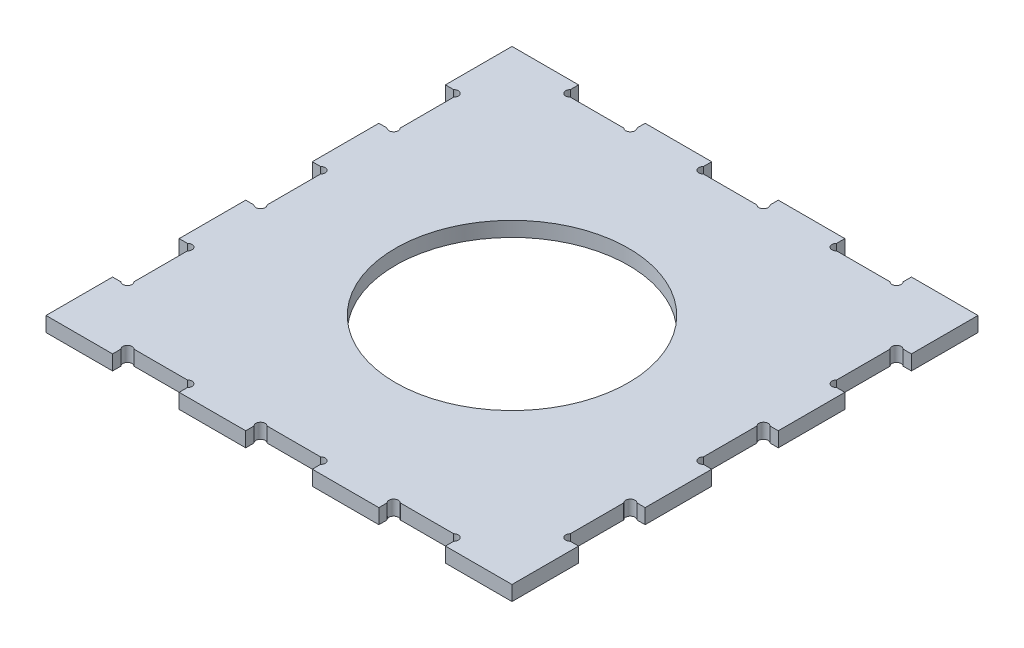
from build123d import *

# Parameters (mm, degrees)
SKETCH1_W                   = 100
SKETCH1_H                   = 100
BOSS_EXTRUDE1_DEPTH         = 3.18
SKETCH2_W                   = 14.285714285
SKETCH2_H                   = 3.18
SKETCH2_W_2                 = 14.285714286
CUT_EXTRUDE1_DEPTH          = 71.782147467
SKETCH3_R                   = 1
CUT_EXTRUDE2_DEPTH          = 71.782147467
SKETCH_PATTERN1_DEPTH       = 3.18
CIRPATTERN1_COUNT           = 4
CIRPATTERN1_COPY_1_SKETCH_R = 1
CIRPATTERN1_COPY_1_DEPTH    = 71.782147467
CIRPATTERN1_COPY_2_SKETCH_R = 1
CIRPATTERN1_COPY_2_DEPTH    = 71.782147467
CIRPATTERN1_COPY_3_SKETCH_R = 1
CIRPATTERN1_COPY_3_DEPTH    = 71.782147467
CIRPATTERN1_COPY_4_DEPTH    = 3.18
CIRPATTERN1_COPY_5_DEPTH    = 3.18
CIRPATTERN1_COPY_6_DEPTH    = 3.18
CUT_EXTRUDE3_DEPTH          = 71.782147467
CUT_EXTRUDE3_DEPTH_BACK     = 71.782147467
SKETCH5_R                   = 25


# Read off the part's stored shape, not the designer's step: Sketch-Pattern1
with BuildPart() as part:
    # Sketch1 → Boss-Extrude1 (new body)
    with BuildSketch(Plane(origin=(0, 0, 0), x_dir=(1, 0, 0), z_dir=(0, 1, 0))):
        Rectangle(SKETCH1_W, SKETCH1_H)
    extrude(amount=BOSS_EXTRUDE1_DEPTH)

    # Sketch2 → Cut-Extrude1 (cut, symmetric)
    with BuildSketch(Plane(origin=(0, 3.18, 0), x_dir=(1, 0, 0), z_dir=(0, 1, 0))):
        with Locations((-28.571428572, 48.41)):
            Rectangle(SKETCH2_W, SKETCH2_H)
        with Locations((0, 48.41)):
            Rectangle(SKETCH2_W_2, SKETCH2_H)
        with Locations((28.571428572, 48.41)):
            Rectangle(SKETCH2_W, SKETCH2_H)
    cut_extrude1 = extrude(amount=CUT_EXTRUDE1_DEPTH, both=True, mode=Mode.SUBTRACT)

    # Sketch3 → Cut-Extrude2 (cut, symmetric)
    with BuildSketch(Plane(origin=(0, 3.18, 0), x_dir=(1, 0, 0), z_dir=(0, 1, 0))):
        with Locations((-35.007178933, 47.527106781)):
            Circle(SKETCH3_R)
    cut_extrude2 = extrude(amount=CUT_EXTRUDE2_DEPTH, both=True, mode=Mode.SUBTRACT)

    # Sketch-Pattern1 outline → Sketch-Pattern1 (cut)
    with BuildSketch(Plane(origin=(0, 0, 0), x_dir=(1, 0, 0), z_dir=(0, 1, 0))):
        with BuildLine():
            Line((-7.142857143, 46.82), (-7.142857143, 48.234213562))
            ThreePointArc((-7.142857143, 48.234213562), (-7.435750362, 47.527106781), (-7.142857143, 46.82))
        make_face()
        with BuildLine():
            Line((-5.72864358, 46.82), (-7.142857143, 46.82))
            ThreePointArc((-7.142857143, 46.82), (-6.435750362, 46.527106781), (-5.72864358, 46.82))
        make_face()
        with BuildLine():
            Line((21.428571429, 46.82), (21.428571429, 48.234213562))
            ThreePointArc((21.428571429, 48.234213562), (21.13567821, 47.527106781), (21.428571429, 46.82))
        make_face()
        with BuildLine():
            Line((22.842784991, 46.82), (21.428571429, 46.82))
            ThreePointArc((21.428571429, 46.82), (22.13567821, 46.527106781), (22.842784991, 46.82))
        make_face()
    sketch_pattern1 = extrude(amount=SKETCH_PATTERN1_DEPTH, mode=Mode.SUBTRACT)

    # Mirror1: Cut-Extrude2, Sketch-Pattern1 across plane
    add(cut_extrude2.mirror(Plane(origin=(0, 0, 0), x_dir=(0, 0, 1), z_dir=(1, 0, 0))), mode=Mode.SUBTRACT)
    add(sketch_pattern1.mirror(Plane(origin=(0, 0, 0), x_dir=(0, 0, 1), z_dir=(1, 0, 0))), mode=Mode.SUBTRACT)

    # CirPattern1: Cut-Extrude1, Cut-Extrude2, Sketch-Pattern1 ×4 about axis
    cirpattern1_axis = Axis((0, 0, 0), (0, 1, 0))
    add([cut_extrude1.rotate(cirpattern1_axis, i * 360 / CIRPATTERN1_COUNT) for i in range(1, CIRPATTERN1_COUNT)], mode=Mode.SUBTRACT)
    add([cut_extrude2.rotate(cirpattern1_axis, i * 360 / CIRPATTERN1_COUNT) for i in range(1, CIRPATTERN1_COUNT)], mode=Mode.SUBTRACT)
    add([sketch_pattern1.rotate(cirpattern1_axis, i * 360 / CIRPATTERN1_COUNT) for i in range(1, CIRPATTERN1_COUNT)], mode=Mode.SUBTRACT)

    # CirPattern1 copy 1 sketch → CirPattern1 copy 1 (cut, symmetric)
    with BuildSketch(Plane.ZX.offset(3.18)):
        with Locations((-35.007178933, -47.527106781)):
            Circle(CIRPATTERN1_COPY_1_SKETCH_R)
    extrude(amount=CIRPATTERN1_COPY_1_DEPTH, both=True, mode=Mode.SUBTRACT)

    # CirPattern1 copy 2 sketch → CirPattern1 copy 2 (cut, symmetric)
    with BuildSketch(Plane(origin=(0, 3.18, 0), x_dir=(1, 0, 0), z_dir=(0, 1, 0))):
        with Locations((-35.007178933, -47.527106781)):
            Circle(CIRPATTERN1_COPY_2_SKETCH_R)
    extrude(amount=CIRPATTERN1_COPY_2_DEPTH, both=True, mode=Mode.SUBTRACT)

    # CirPattern1 copy 3 sketch → CirPattern1 copy 3 (cut, symmetric)
    with BuildSketch(Plane(origin=(0, 3.18, 0), x_dir=(0, 0, -1), z_dir=(0, 1, 0))):
        with Locations((-35.007178933, -47.527106781)):
            Circle(CIRPATTERN1_COPY_3_SKETCH_R)
    extrude(amount=CIRPATTERN1_COPY_3_DEPTH, both=True, mode=Mode.SUBTRACT)

    # CirPattern1 copy 4 sketch → CirPattern1 copy 4 (cut)
    with BuildSketch(Plane.ZX):
        with BuildLine():
            Line((-7.142857143, -46.82), (-7.142857143, -48.234213562))
            ThreePointArc((-7.142857143, -48.234213562), (-7.435750362, -47.527106781), (-7.142857143, -46.82))
        make_face()
        with BuildLine():
            Line((-5.72864358, -46.82), (-7.142857143, -46.82))
            ThreePointArc((-7.142857143, -46.82), (-6.435750362, -46.527106781), (-5.72864358, -46.82))
        make_face()
        with BuildLine():
            Line((21.428571429, -46.82), (21.428571429, -48.234213562))
            ThreePointArc((21.428571429, -48.234213562), (21.13567821, -47.527106781), (21.428571429, -46.82))
        make_face()
        with BuildLine():
            Line((22.842784991, -46.82), (21.428571429, -46.82))
            ThreePointArc((21.428571429, -46.82), (22.13567821, -46.527106781), (22.842784991, -46.82))
        make_face()
    extrude(amount=CIRPATTERN1_COPY_4_DEPTH, mode=Mode.SUBTRACT)

    # CirPattern1 copy 5 sketch → CirPattern1 copy 5 (cut)
    with BuildSketch(Plane(origin=(0, 0, 0), x_dir=(1, 0, 0), z_dir=(0, 1, 0))):
        with BuildLine():
            Line((-7.142857143, -46.82), (-7.142857143, -48.234213562))
            ThreePointArc((-7.142857143, -48.234213562), (-7.435750362, -47.527106781), (-7.142857143, -46.82))
        make_face()
        with BuildLine():
            Line((-5.72864358, -46.82), (-7.142857143, -46.82))
            ThreePointArc((-7.142857143, -46.82), (-6.435750362, -46.527106781), (-5.72864358, -46.82))
        make_face()
        with BuildLine():
            Line((21.428571429, -46.82), (21.428571429, -48.234213562))
            ThreePointArc((21.428571429, -48.234213562), (21.13567821, -47.527106781), (21.428571429, -46.82))
        make_face()
        with BuildLine():
            Line((22.842784991, -46.82), (21.428571429, -46.82))
            ThreePointArc((21.428571429, -46.82), (22.13567821, -46.527106781), (22.842784991, -46.82))
        make_face()
    extrude(amount=CIRPATTERN1_COPY_5_DEPTH, mode=Mode.SUBTRACT)

    # CirPattern1 copy 6 sketch → CirPattern1 copy 6 (cut)
    with BuildSketch(Plane(origin=(0, 0, 0), x_dir=(0, 0, -1), z_dir=(0, 1, 0))):
        with BuildLine():
            Line((-7.142857143, -46.82), (-7.142857143, -48.234213562))
            ThreePointArc((-7.142857143, -48.234213562), (-7.435750362, -47.527106781), (-7.142857143, -46.82))
        make_face()
        with BuildLine():
            Line((-5.72864358, -46.82), (-7.142857143, -46.82))
            ThreePointArc((-7.142857143, -46.82), (-6.435750362, -46.527106781), (-5.72864358, -46.82))
        make_face()
        with BuildLine():
            Line((21.428571429, -46.82), (21.428571429, -48.234213562))
            ThreePointArc((21.428571429, -48.234213562), (21.13567821, -47.527106781), (21.428571429, -46.82))
        make_face()
        with BuildLine():
            Line((22.842784991, -46.82), (21.428571429, -46.82))
            ThreePointArc((21.428571429, -46.82), (22.13567821, -46.527106781), (22.842784991, -46.82))
        make_face()
    extrude(amount=CIRPATTERN1_COPY_6_DEPTH, mode=Mode.SUBTRACT)

    # Sketch5 → Cut-Extrude3 (cut, two sides: drawn at the far end of the back side and taken through both)
    with BuildSketch(Plane(origin=(0, 3.18, 0), x_dir=(1, 0, 0), z_dir=(0, 1, 0)).offset(-CUT_EXTRUDE3_DEPTH_BACK)):
        with Locations(Location((0, 0, 0), (0, 0, 270))):
            Circle(SKETCH5_R)
    extrude(amount=CUT_EXTRUDE3_DEPTH + CUT_EXTRUDE3_DEPTH_BACK, mode=Mode.SUBTRACT)


solid = part.part
